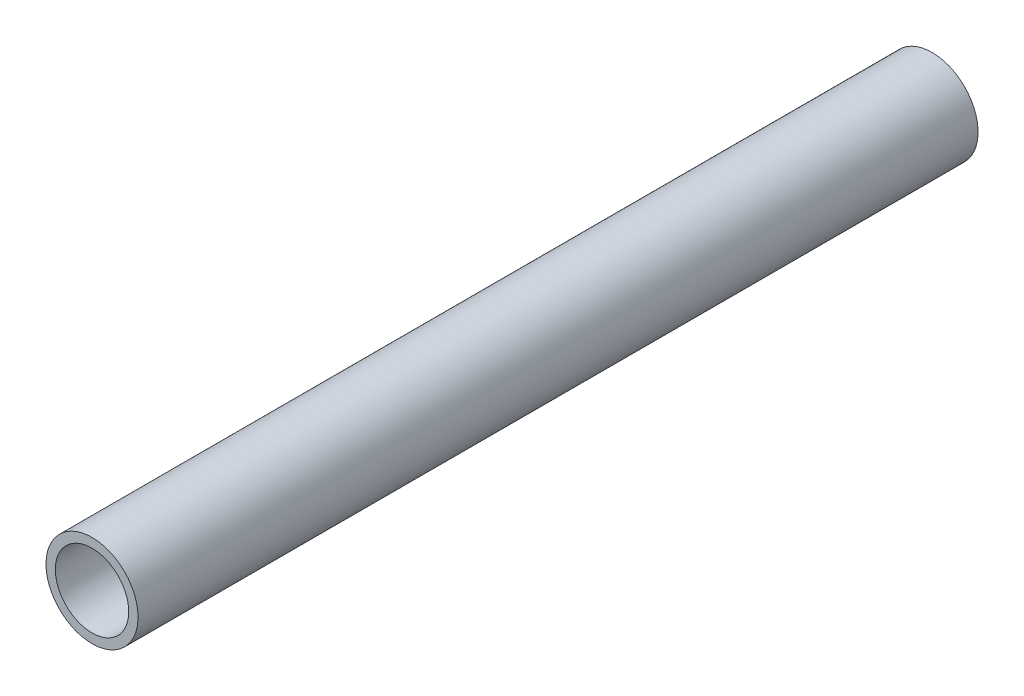
from build123d import *

# Parameters (mm, degrees)
SKETCH2_R          = 16.7005
SKETCH2_R_2        = 13.3223
PIPE_EXTRUDE_DEPTH = 152.4


with BuildPart() as part:
    # Sketch2 → Pipe Extrude (new, symmetric)
    with BuildSketch(Plane.XY):
        Circle(SKETCH2_R)
        Circle(SKETCH2_R_2, mode=Mode.SUBTRACT)
    extrude(amount=PIPE_EXTRUDE_DEPTH, both=True)


solid = part.part
